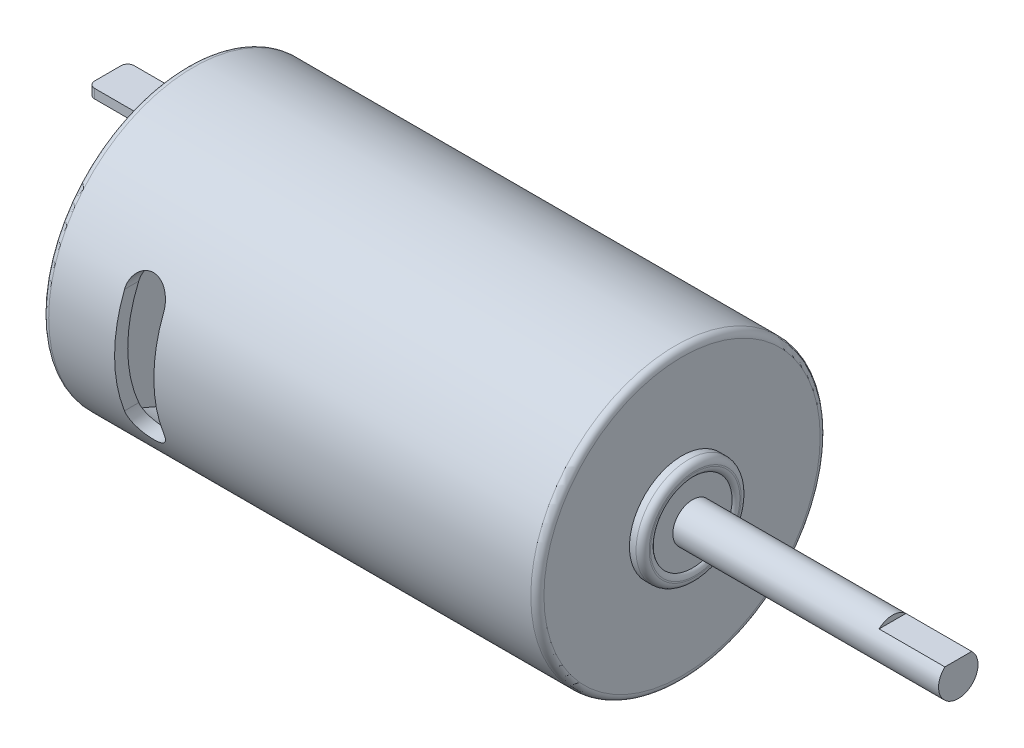
from build123d import *

# Parameters (mm, degrees)
SKETCH_1_R          = 11
EXTRUDE_1_DEPTH     = 18.825
SKETCH_3_R          = 10
CUT_EXTRUDE_1_DEPTH = 17.825
CUT_EXTRUDE_2_DEPTH = 25.420905491
FILLET_1_R          = 0.5
SKETCH_5_W          = 3
SKETCH_5_H          = 0.7
EXTRUDE_2_DEPTH     = 6
FILLET_2_R          = 0.5
SKETCH_7_R          = 3.5
EXTRUDE_3_DEPTH     = 1
SKETCH_8_R          = 1.5
EXTRUDE_4_DEPTH     = 20
CUT_EXTRUDE_START   = -5
CUT_EXTRUDE_3_DEPTH = 5
SKETCH_10_R         = 4
EXTRUDE_5_DEPTH     = 1
FILLET_4_R          = 0.5
CUT_EXTRUDE_START_2 = -0.2
SKETCH_11_R         = 3
SKETCH_11_R_2       = 1.5
CUT_EXTRUDE_4_DEPTH = 0.2
FILLET_5_R          = 0.5


with BuildPart() as part:
    # 草图1 → 凸台-拉伸1 (new, symmetric)
    with BuildSketch(Plane(origin=(0, 0, 0), x_dir=(0, 0, -1), z_dir=(1, 0, 0))):
        with Locations(Location((0, 0, 0), (0, 0, 180))):
            Circle(SKETCH_1_R)
    extrude(amount=EXTRUDE_1_DEPTH, both=True)

    # 草图3 → 切除-拉伸1 (cut, symmetric)
    with BuildSketch(Plane(origin=(0, 0, 0), x_dir=(0, 0, -1), z_dir=(1, 0, 0))):
        Circle(SKETCH_3_R)
    extrude(amount=CUT_EXTRUDE_1_DEPTH, both=True, mode=Mode.SUBTRACT)

    # 草图4 → 切除-拉伸2 (cut, through all)
    with BuildSketch(Plane.XY):
        with BuildLine():
            Line((-10.332925503, 4), (-10.332925503, -4))
            ThreePointArc((-10.332925503, -4), (-11.825, -5.492074497), (-13.317074497, -4))
            Line((-13.317074497, -4), (-13.317074497, 4))
            ThreePointArc((-13.317074497, 4), (-11.825, 5.492074497), (-10.332925503, 4))
        make_face()
    extrude(amount=CUT_EXTRUDE_2_DEPTH, mode=Mode.SUBTRACT)

    # 圆角1
    fillet_1_edges = [part.edges().sort_by_distance(p)[0] for p in [
        (-18.825, 0, -11),
        (18.825, 0, -11),
    ]]
    fillet(fillet_1_edges, radius=FILLET_1_R)

    # 草图5 → 凸台-拉伸2 (add)
    with BuildSketch(Plane.ZY.offset(18.825)):
        with Locations((0, 7)):
            Rectangle(SKETCH_5_W, SKETCH_5_H)
        with Locations((0, -7)):
            Rectangle(SKETCH_5_W, SKETCH_5_H)
    extrude(amount=EXTRUDE_2_DEPTH)

    # 圆角2
    fillet_2_edges = [part.edges().sort_by_distance(p)[0] for p in [
        (-24.825, 7, 1.5),
        (-24.825, 7, -1.5),
        (-24.825, -7, -1.5),
        (-24.825, -7, 1.5),
    ]]
    fillet(fillet_2_edges, radius=FILLET_2_R)

    # 草图7 → 凸台-拉伸3 (add)
    with BuildSketch(Plane(origin=(18.825, 0, 0), x_dir=(0, 0, -1), z_dir=(1, 0, 0))):
        Circle(SKETCH_7_R)
    extrude(amount=EXTRUDE_3_DEPTH)

    # 草图8 → 凸台-拉伸4 (add)
    with BuildSketch(Plane(origin=(19.825, 0, 0), x_dir=(0, 0, -1), z_dir=(1, 0, 0))):
        Circle(SKETCH_8_R)
    extrude(amount=EXTRUDE_4_DEPTH)

    # 草图9 → 切除-拉伸3 (cut)
    with BuildSketch(Plane(origin=(39.825, 0, 0), x_dir=(0, 0, -1), z_dir=(1, 0, 0)).offset(CUT_EXTRUDE_START)):
        with BuildLine():
            Line((-1.019803903, 1.1), (1.019803903, 1.1))
            ThreePointArc((1.019803903, 1.1), (0, 1.5), (-1.019803903, 1.1))
        make_face()
    extrude(amount=CUT_EXTRUDE_3_DEPTH, mode=Mode.SUBTRACT)

    # 草图10 → 凸台-拉伸5 (add)
    with BuildSketch(Plane(origin=(18.825, 0, 0), x_dir=(0, 0, -1), z_dir=(1, 0, 0))):
        Circle(SKETCH_10_R)
    extrude(amount=EXTRUDE_5_DEPTH)

    # 圆角4
    fillet_4_edges = [part.edges().sort_by_distance(p)[0] for p in [
        (19.825, 0, 4),
    ]]
    fillet(fillet_4_edges, radius=FILLET_4_R)

    # 草图11 → 切除-拉伸4 (cut)
    with BuildSketch(Plane(origin=(19.825, 0, 0), x_dir=(0, 0, -1), z_dir=(1, 0, 0)).offset(CUT_EXTRUDE_START_2)):
        Circle(SKETCH_11_R)
        with Locations(Location((0, 0, 0), (0, 0, 132.833428066))):
            Circle(SKETCH_11_R_2, mode=Mode.SUBTRACT)
    extrude(amount=CUT_EXTRUDE_4_DEPTH, mode=Mode.SUBTRACT)

    # 圆角5
    # the kernel refuses this fillet: 0.5 mm, written as the material it takes off along each edge
    with BuildSketch(Plane(origin=(19.825, 0, 0), x_dir=(0, 0, -1), z_dir=(0, -1, 0))) as fillet_5_piece_1:
        with BuildLine():
            CenterArc((3.4, -0.5), FILLET_5_R, 90, 53.130102355)
            Line((3, -0.2), (2.992, -0.194))
            ThreePointArc((2.992, -0.194), (2.99, -0.1), (2.99, 0))
            Line((2.99, 0), (3, 0.01))
            Line((3, 0.01), (3.4, 0.01))
            Line((3.4, 0.01), (3.4, 0))
        make_face()
    revolve(axis=Axis((19.825, 0, 0), (1, 0, 0)), mode=Mode.SUBTRACT)


solid = part.part
